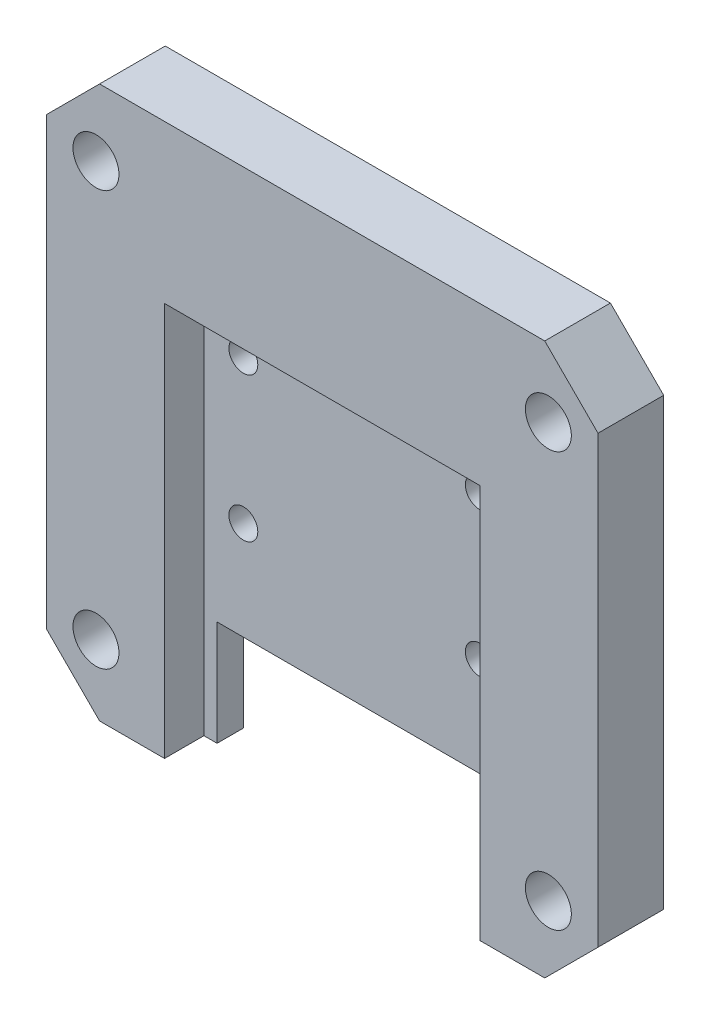
from build123d import *

# Parameters (mm, degrees)
SKETCH1_R               = 1.75
BOSS_EXTRUDE1_DEPTH     = 5
CUT_EXTRUDE1_DEPTH      = 60.607046563
CUT_EXTRUDE1_DEPTH_BACK = 60.607046563
SKETCH2_W               = 22
SKETCH2_H               = 8
SKETCH3_W               = 24
SKETCH3_H               = 30
CUT_EXTRUDE2_DEPTH      = 3
SKETCH4_R               = 1.1
CUT_EXTRUDE3_DEPTH      = 3


with BuildPart() as part:
    # Sketch1 → Boss-Extrude1 (new body)
    with BuildSketch(Plane.XY):
        Polygon((4.055, 42), (0, 37.945), (0, 4.055), (4.055, 0), (37.945, 0), (42, 4.055), (42, 37.945), (37.945, 42), align=None)
        with Locations((3.779747468, 36.775)):
            Circle(SKETCH1_R, mode=Mode.SUBTRACT)
        with Locations((3.779747468, 5.225)):
            Circle(SKETCH1_R, mode=Mode.SUBTRACT)
        with Locations((38.220252532, 5.225)):
            Circle(SKETCH1_R, mode=Mode.SUBTRACT)
        with Locations((38.220252532, 36.775)):
            Circle(SKETCH1_R, mode=Mode.SUBTRACT)
    extrude(amount=BOSS_EXTRUDE1_DEPTH)

    # Sketch2 → Cut-Extrude1 (cut, two sides: drawn at the far end of the back side and taken through both)
    with BuildSketch(Plane.XY.offset(5).offset(-CUT_EXTRUDE1_DEPTH_BACK)):
        with Locations((21, 4)):
            Rectangle(SKETCH2_W, SKETCH2_H)
    extrude(amount=CUT_EXTRUDE1_DEPTH + CUT_EXTRUDE1_DEPTH_BACK, mode=Mode.SUBTRACT)

    # Sketch3 → Cut-Extrude2 (cut)
    with BuildSketch(Plane.XY.offset(5)):
        with Locations((21, 15)):
            Rectangle(SKETCH3_W, SKETCH3_H)
    extrude(amount=-CUT_EXTRUDE2_DEPTH, mode=Mode.SUBTRACT)

    # Sketch4 → Cut-Extrude3 (cut)
    with BuildSketch(Plane.XY.offset(2)):
        with Locations((12, 26.5)):
            Circle(SKETCH4_R)
        with Locations((30, 26.5)):
            Circle(SKETCH4_R)
        with Locations((12, 15.5)):
            Circle(SKETCH4_R)
        with Locations((30, 15.5)):
            Circle(SKETCH4_R)
    extrude(amount=-CUT_EXTRUDE3_DEPTH, mode=Mode.SUBTRACT)


solid = part.part
